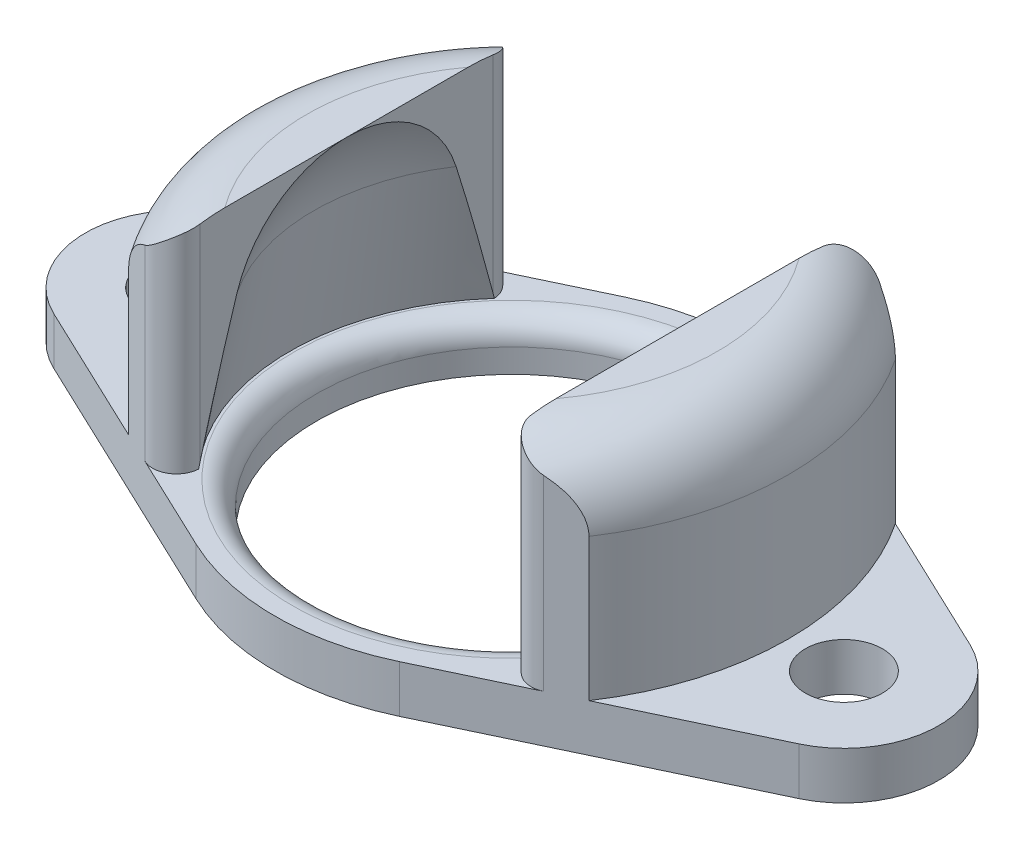
from build123d import *

# Parameters (mm, degrees)
CROQUIS1_W              = 36
CROQUIS1_H              = 20.3
CROQUIS1_R              = 1.625
SALIENTE_EXTRUIR1_DEPTH = 2
CORTAR_EXTRUIR2_DEPTH   = 28.2045952
CROQUIS4_R              = 8.25
CORTAR_EXTRUIR3_DEPTH   = 4
CORTAR_EXTRUIR4_START   = -14
CORTAR_EXTRUIR4_DEPTH   = 14
CORTAR_EXTRUIR5_REACH   = 31.172
CROQUIS7_W              = 13.96
CROQUIS7_H              = 19.999999722
REDONDEO1_START         = 2
REDONDEO1_DEPTH         = 9.000000496
REDONDEO2_R             = 1


with BuildPart() as part:
    # Croquis1 → Saliente-Extruir1 (new body)
    with BuildSketch(Plane(origin=(0, 0, 0), x_dir=(1, 0, 0), z_dir=(0, 1, 0))):
        with Locations((0, 10.15)):
            Rectangle(CROQUIS1_W, CROQUIS1_H)
        with Locations(Location((-14, 10.15, 0), (0, 0, 270))):
            Circle(CROQUIS1_R, mode=Mode.SUBTRACT)
        with Locations(Location((14, 10.15, 0), (0, 0, 90))):
            Circle(CROQUIS1_R, mode=Mode.SUBTRACT)
    extrude(amount=SALIENTE_EXTRUIR1_DEPTH)

    # Croquis3 → Cortar-Extruir2 (cut, through all)
    with BuildSketch(Plane(origin=(0, 2, 0), x_dir=(1, 0, 0), z_dir=(0, 1, 0))):
        with BuildLine():
            ThreePointArc((-18, 10.15), (-17.380616997, 12.28808997), (-15.714285639, 13.764031647))
            Line((-15.714285639, 13.764031647), (-4.285714097, 19.185078827))
            ThreePointArc((-4.285714097, 19.185078827), (1.04e-07, 20.149999708), (4.285714286, 19.185078737))
            Line((4.285714286, 19.185078737), (15.714285714, 13.764031612))
            ThreePointArc((15.714285714, 13.764031612), (17.380617007, 12.288089954), (18, 10.150000044))
            Line((18, 10.150000044), (18, 20.3))
            Line((18, 20.3), (-18, 20.3))
            Line((-18, 20.3), (-18, 10.15))
        make_face()
        with BuildLine():
            ThreePointArc((-15.714285714, 6.535968388), (-17.380617019, 8.011910065), (-18, 10.15))
            Line((-18, 10.15), (-18, -5.84e-07))
            Line((-18, -5.84e-07), (18, -5.84e-07))
            Line((18, -5.84e-07), (18, 10.150000044))
            ThreePointArc((18, 10.150000044), (17.380617031, 8.011910083), (15.714285714, 6.535968388))
            Line((15.714285714, 6.535968388), (4.285714286, 1.114920679))
            ThreePointArc((4.285714286, 1.114920679), (0, 0.149999708), (-4.285714286, 1.114920679))
            Line((-4.285714286, 1.114920679), (-15.714285714, 6.535968388))
        make_face()
    extrude(amount=-CORTAR_EXTRUIR2_DEPTH, mode=Mode.SUBTRACT)

    # Croquis4 → Cortar-Extruir3 (cut)
    with BuildSketch(Plane(origin=(0, 2, 0), x_dir=(1, 0, 0), z_dir=(0, 1, 0))):
        with Locations(Location((0, 10.149999708, 0), (0, 0, 270))):
            Circle(CROQUIS4_R)
    extrude(amount=-CORTAR_EXTRUIR3_DEPTH, mode=Mode.SUBTRACT)

    # Croquis5 → Revolución1 (revolve)
    with BuildSketch(Plane.XY.offset(-10.15), mode=Mode.PRIVATE) as revoluci_n1_sk:
        with BuildLine():
            Line((-8.370865901, 7.62600951), (-9.362883171, 2))
            Line((-9.362883171, 2), (-11.662883171, 2))
            Line((-11.662883171, 2), (-11.662883171, 8))
            ThreePointArc((-11.662883171, 8), (-10.784203515, 10.121320344), (-8.662883171, 11))
            Line((-8.662883171, 11), (-6.980508577, 11))
            ThreePointArc((-6.980508577, 11), (-7.858888442, 9.388498487), (-8.370865901, 7.62600951))
        make_face()
    revolve(revoluci_n1_sk.sketch.rotate(Axis((0, -1000, -10.15), (0, 1, 0)), 180), axis=Axis((0, -1000, -10.15), (0, 1, 0)))

    # Croquis6 → Cortar-Extruir4 (cut)
    with BuildSketch(Plane.XZ.offset(-2).offset(CORTAR_EXTRUIR4_START)):
        with BuildLine():
            ThreePointArc((-4.285714286, -1.114920679), (0, -0.149999708), (4.285714286, -1.114920679))
            Line((4.285714286, -1.114920679), (9.708481547, -3.687165044))
            ThreePointArc((9.708481547, -3.687165044), (0, 1.537504876), (-9.708481547, -3.687165044))
            Line((-9.708481547, -3.687165044), (-4.285714286, -1.114920679))
        make_face()
        with BuildLine():
            Line((9.708481547, -16.612834511), (4.285714286, -19.185078876))
            ThreePointArc((4.285714286, -19.185078876), (0, -20.149999847), (-4.285714286, -19.185078876))
            Line((-4.285714286, -19.185078876), (-9.708481547, -16.612834511))
            ThreePointArc((-9.708481547, -16.612834511), (0, -21.837504431), (9.708481547, -16.612834511))
        make_face()
    extrude(amount=CORTAR_EXTRUIR4_DEPTH, mode=Mode.SUBTRACT)

    # Cortar-Extruir5: up to this face of the body (flat: up to its plane)
    cortar_extruir5_end = Plane(part.part.faces().sort_by_distance((-12.645570007, 2, -15.049685851))[0])
    # Croquis7 → Cortar-Extruir5 (cut, up to the picked face)
    with BuildSketch(Plane(origin=(0, 11, 0), x_dir=(1, 0, 0), z_dir=(0, 1, 0)), mode=Mode.PRIVATE) as cortar_extruir5_sk1:
        with Locations((0, 10.15)):
            Rectangle(CROQUIS7_W, CROQUIS7_H)
    cortar_extruir5_tool1 = split(extrude(cortar_extruir5_sk1.sketch, amount=-CORTAR_EXTRUIR5_REACH, mode=Mode.PRIVATE), bisect_by=cortar_extruir5_end, keep=Keep.BOTH, mode=Mode.PRIVATE)
    add(cortar_extruir5_tool1.solids().sort_by(Axis((0, 11, -10.15), (0, -1, 0)))[0], mode=Mode.SUBTRACT)

    # Redondeo1: read off the stored shape, not the designer's step
    # Redondeo1 outline → Redondeo1 (cut)
    with BuildSketch(Plane(origin=(0, 0, 0), x_dir=(1, 0, 0), z_dir=(0, 1, 0)).offset(REDONDEO1_START)):
        with BuildLine():
            ThreePointArc((6.98, 16.325928084), (7.445477507, 17.171082333), (8.40857141, 17.229435996))
            Line((8.40857141, 17.229435996), (6.98, 17.907066877))
            Line((6.98, 17.907066877), (6.98, 16.325928084))
        make_face()
        with BuildLine():
            Line((6.98, 2.392932676), (8.408571447, 3.070563649))
            ThreePointArc((8.408571447, 3.070563649), (7.445477525, 3.128917283), (6.98, 3.974071543))
            Line((6.98, 3.974071543), (6.98, 2.392932676))
        make_face()
        with BuildLine():
            Line((-6.98, 17.907066877), (-8.408571426, 17.229435988))
            ThreePointArc((-8.408571426, 17.229435988), (-7.445477515, 17.171082338), (-6.98, 16.325928084))
            Line((-6.98, 16.325928084), (-6.98, 17.907066877))
        make_face()
        with BuildLine():
            ThreePointArc((-6.98, 3.974071543), (-7.445477525, 3.128917283), (-8.408571447, 3.070563649))
            Line((-8.408571447, 3.070563649), (-6.98, 2.392932676))
            Line((-6.98, 2.392932676), (-6.98, 3.974071543))
        make_face()
    extrude(amount=REDONDEO1_DEPTH, mode=Mode.SUBTRACT)

    # Redondeo2
    redondeo2_edges = [part.edges().sort_by_distance(p)[0] for p in [
        (0, 2, -18.399999708),
    ]]
    fillet(redondeo2_edges, radius=REDONDEO2_R)


solid = part.part
